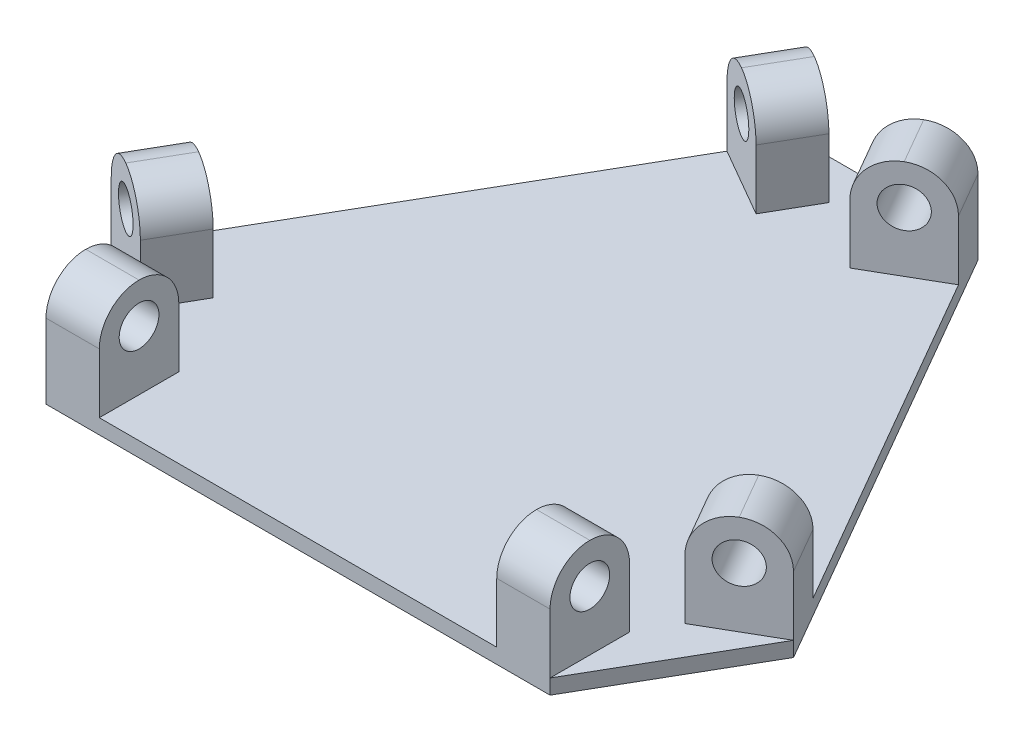
from build123d import *

# Parameters (mm, degrees)
BOSS_EXTRUDE2_DEPTH      = 1.5
SKETCH4_W                = 5.364695745
SKETCH4_H                = 8
BOSS_EXTRUDE3_DEPTH      = 10
SKETCH5_R                = 2
CUT_EXTRUDE2_DEPTH       = 70.885624116
FILLET1_R                = 4
CIRPATTERN1_COUNT        = 3
FILLET1_OF_CIRPATTERN1_R = 4


with BuildPart() as part:
    # Sketch3 → Boss-Extrude2 (new body)
    with BuildSketch(Plane(origin=(0, 0, 0), x_dir=(1, 0, 0), z_dir=(0, 1, 0))):
        Polygon((-8.968287222, 34.466470874), (8.968287222, 34.466470874), (34.332982967, -9.466470874), (25.364695745, -25), (-25.364695745, -25), (-34.332982967, -9.466470874), align=None)
    extrude(amount=BOSS_EXTRUDE2_DEPTH)

    # Sketch4 → Boss-Extrude3 (add)
    with BuildSketch(Plane(origin=(0, 1.5, 0), x_dir=(1, 0, 0), z_dir=(0, 1, 0))):
        with Locations((-22.682347873, -21)):
            Rectangle(SKETCH4_W, SKETCH4_H)
        with Locations((22.682347873, -21)):
            Rectangle(SKETCH4_W, SKETCH4_H)
    boss_extrude3 = extrude(amount=BOSS_EXTRUDE3_DEPTH)

    # Sketch5 → Cut-Extrude2 (cut, through all)
    with BuildSketch(Plane(origin=(25.364695745, 0, 0), x_dir=(0, 0, -1), z_dir=(1, 0, 0))):
        with Locations((-21, 7.5)):
            Circle(SKETCH5_R)
    cut_extrude2 = extrude(amount=-CUT_EXTRUDE2_DEPTH, mode=Mode.SUBTRACT)

    # Fillet1
    fillet1_edges = [part.edges().sort_by_distance(p)[0] for p in [
        (-22.682347872, 11.5, 17),
        (-22.682347872, 11.5, 25),
        (22.682347872, 11.5, 17),
        (22.682347872, 11.5, 25),
    ]]
    fillet(fillet1_edges, radius=FILLET1_R - 0.0001)  # a hair under: the kernel refuses the full size

    # CirPattern1: Boss-Extrude3, Cut-Extrude2 ×3 about axis
    cirpattern1_axis = Axis((0, 0, 0), (0, 1, 0))
    add([boss_extrude3.rotate(cirpattern1_axis, i * 360 / CIRPATTERN1_COUNT) for i in range(1, CIRPATTERN1_COUNT)])
    add([cut_extrude2.rotate(cirpattern1_axis, i * 360 / CIRPATTERN1_COUNT) for i in range(1, CIRPATTERN1_COUNT)], mode=Mode.SUBTRACT)

    # Fillet1 of CirPattern1
    fillet1_of_cirpattern1_edges = [part.edges().sort_by_distance(p)[0] for p in [
        (26.063605801, 11.5, 11.143489475),
        (32.991809031, 11.5, 7.143489475),
        (3.381257928, 11.5, -28.143489475),
        (10.309461158, 11.5, -32.143489475),
        (-3.381257928, 11.5, -28.143489475),
        (-10.309461158, 11.5, -32.143489475),
        (-26.063605801, 11.5, 11.143489475),
        (-32.991809031, 11.5, 7.143489475),
    ]]
    fillet(fillet1_of_cirpattern1_edges, radius=FILLET1_OF_CIRPATTERN1_R - 0.0001)  # a hair under: the kernel refuses the full size


solid = part.part
